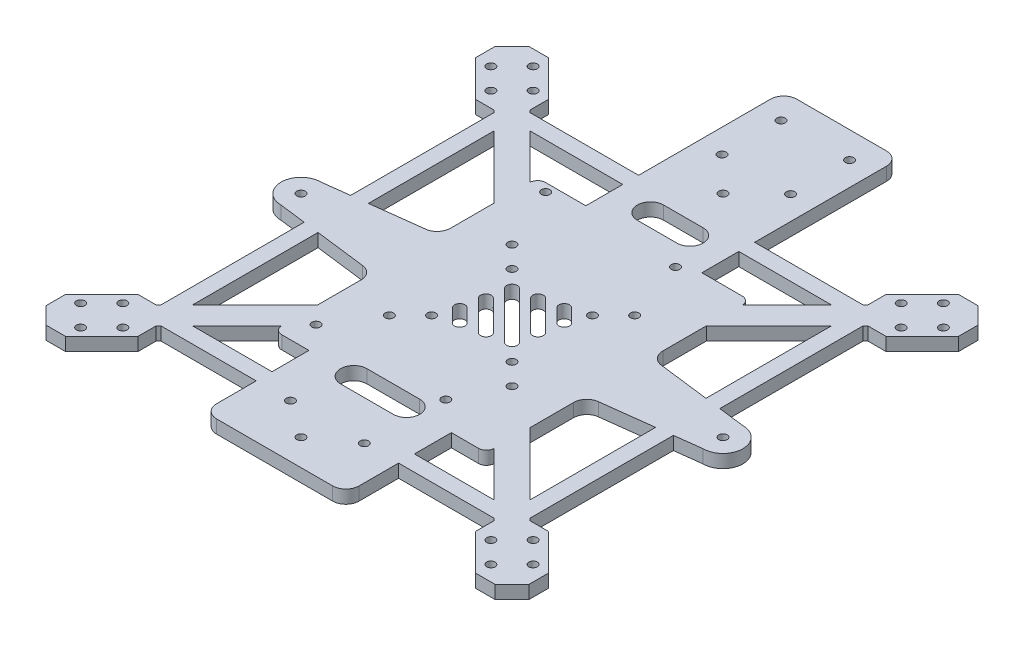
from build123d import *

# Parameters (mm, degrees)
SKETCH_1_R           = 1.6
EXTRUDE_1_DEPTH      = 5
SKETCH_6_R           = 1.6
EXTRUDE_3_DEPTH      = 5
SKETCH_7_R           = 1.6
CUT_EXTRUDE_5_DEPTH  = 130.541966274
SKETCH_8_W           = 44
SKETCH_8_H           = 75
SKETCH_8_R           = 1.6
EXTRUDE_4_DEPTH      = 5
FILLET_1_R           = 5
FILLET_2_R           = 3
EXTRUDE_6_DEPTH      = 5
SKETCH_10_R          = 1.6
CUT_EXTRUDE_10_DEPTH = 156.009872308


with BuildPart() as part:
    # 草图1 → 凸台-拉伸1 (new body)
    with BuildSketch(Plane(origin=(0, 0, 0), x_dir=(1, 0, 0), z_dir=(0, 1, 0))):
        with BuildLine():
            Line((-40.28, -16.916429648), (-40.28, -50))
            Line((-40.28, -50), (-27, -50))
            Line((-27, -50), (-27, -90))
            Line((-27, -90), (27, -90))
            Line((27, -90), (27, -50))
            Line((27, -50), (40.28, -50))
            Line((40.28, -50), (40.28, -16.916429648))
            ThreePointArc((40.28, -16.916429648), (41.5325458, -13.606356081), (44.662634807, -11.954690012))
            Line((44.662634807, -11.954690012), (80, -7.557833088))
            ThreePointArc((80, -7.557833088), (87.557833088, 0), (80, 7.557833088))
            Line((80, 7.557833088), (44.662634807, 11.954690012))
            ThreePointArc((44.662634807, 11.954690012), (41.5325458, 13.606356081), (40.28, 16.916429648))
            Line((40.28, 16.916429648), (40.28, 50))
            Line((40.28, 50), (-40.28, 50))
            Line((-40.28, 50), (-40.28, 16.916429648))
            ThreePointArc((-40.28, 16.916429648), (-41.5325458, 13.606356081), (-44.662634807, 11.954690012))
            Line((-44.662634807, 11.954690012), (-80, 7.557833088))
            ThreePointArc((-80, 7.557833088), (-87.557833088, 0), (-80, -7.557833088))
            Line((-80, -7.557833088), (-44.662634807, -11.954690012))
            ThreePointArc((-44.662634807, -11.954690012), (-41.5325458, -13.606356081), (-40.28, -16.916429648))
        make_face()
        with Locations(Location((-34.12, -40.19, 0), (0, 0, 270))):
            Circle(SKETCH_1_R, mode=Mode.SUBTRACT)
        with Locations(Location((15.09, -40.19, 0), (0, 0, 270))):
            Circle(SKETCH_1_R, mode=Mode.SUBTRACT)
        with Locations(Location((-80, 0, 0), (0, 0, 270))):
            Circle(SKETCH_1_R, mode=Mode.SUBTRACT)
        with Locations(Location((-15.25, -15.25, 0), (0, 0, 270))):
            Circle(SKETCH_1_R, mode=Mode.SUBTRACT)
        with Locations(Location((-15.25, 15.25, 0), (0, 0, 270))):
            Circle(SKETCH_1_R, mode=Mode.SUBTRACT)
        with Locations(Location((-34.12, 46.89, 0), (0, 0, 270))):
            Circle(SKETCH_1_R, mode=Mode.SUBTRACT)
        with Locations(Location((15.25, -15.25, 0), (0, 0, 270))):
            Circle(SKETCH_1_R, mode=Mode.SUBTRACT)
        with Locations(Location((80, 0, 0), (0, 0, 270))):
            Circle(SKETCH_1_R, mode=Mode.SUBTRACT)
        with Locations(Location((15.25, 15.25, 0), (0, 0, 270))):
            Circle(SKETCH_1_R, mode=Mode.SUBTRACT)
        with Locations(Location((15.09, 46.89, 0), (0, 0, 270))):
            Circle(SKETCH_1_R, mode=Mode.SUBTRACT)
        with Locations(Location((14, -70, 0), (0, 0, 270))):
            Circle(SKETCH_1_R, mode=Mode.SUBTRACT)
        with Locations(Location((-14, -70, 0), (0, 0, 270))):
            Circle(SKETCH_1_R, mode=Mode.SUBTRACT)
    extrude(amount=EXTRUDE_1_DEPTH)

    # 草图6 → 凸台-拉伸3 (add)
    # profile 1 of 4: a face of its own
    with BuildSketch(Plane(origin=(0, 0, 0), x_dir=(1, 0, 0), z_dir=(0, 1, 0))):
        Polygon((-40.28, 33.405), (-40.28, 47.155), (-64.031745931, 70.906745931), (-64.031745931, 77.781745931), (-77.781745931, 91.531745931), (-85.1677849, 91.531745931), (-91.531745931, 85.1677849), (-91.531745931, 77.781745931), (-77.781745931, 64.031745931), (-70.906745931, 64.031745931), align=None)
        with Locations(Location((-85.781745931, 77.781745931, 0), (0, 0, 270))):
            Circle(SKETCH_6_R, mode=Mode.SUBTRACT)
        with Locations(Location((-77.781745931, 69.781745931, 0), (0, 0, 270))):
            Circle(SKETCH_6_R, mode=Mode.SUBTRACT)
        with Locations(Location((-69.781745931, 77.781745931, 0), (0, 0, 270))):
            Circle(SKETCH_6_R, mode=Mode.SUBTRACT)
        with Locations(Location((-77.781745931, 85.781745931, 0), (0, 0, 270))):
            Circle(SKETCH_6_R, mode=Mode.SUBTRACT)
    # profile 2 of 4: a face of its own
    with BuildSketch(Plane(origin=(0, 0, 0), x_dir=(1, 0, 0), z_dir=(0, 1, 0))):
        Polygon((85.1677849, 91.531745931), (77.781745931, 91.531745931), (64.031745931, 77.781745931), (64.031745931, 70.906745931), (40.28, 47.155), (40.28, 33.405), (70.906745931, 64.031745931), (77.781745931, 64.031745931), (91.531745931, 77.781745931), (91.531745931, 85.1677849), align=None)
        with Locations(Location((77.781745931, 69.781745931, 0), (0, 0, 270))):
            Circle(SKETCH_6_R, mode=Mode.SUBTRACT)
        with Locations(Location((69.781745931, 77.781745931, 0), (0, 0, 270))):
            Circle(SKETCH_6_R, mode=Mode.SUBTRACT)
        with Locations(Location((85.781745931, 77.781745931, 0), (0, 0, 270))):
            Circle(SKETCH_6_R, mode=Mode.SUBTRACT)
        with Locations(Location((77.781745931, 85.781745931, 0), (0, 0, 270))):
            Circle(SKETCH_6_R, mode=Mode.SUBTRACT)
    # profile 3 of 4: a face of its own
    with BuildSketch(Plane(origin=(0, 0, 0), x_dir=(1, 0, 0), z_dir=(0, 1, 0))):
        Polygon((70.906745931, -64.031745931), (40.28, -33.405), (40.28, -47.155), (64.031745931, -70.906745931), (64.031745931, -77.781745931), (77.781745931, -91.531745931), (85.1677849, -91.531745931), (91.531745931, -85.1677849), (91.531745931, -77.781745931), (77.781745931, -64.031745931), align=None)
        with Locations(Location((77.781745931, -85.781745931, 0), (0, 0, 270))):
            Circle(SKETCH_6_R, mode=Mode.SUBTRACT)
        with Locations(Location((69.781745931, -77.781745931, 0), (0, 0, 270))):
            Circle(SKETCH_6_R, mode=Mode.SUBTRACT)
        with Locations(Location((77.781745931, -69.781745931, 0), (0, 0, 270))):
            Circle(SKETCH_6_R, mode=Mode.SUBTRACT)
        with Locations(Location((85.781745931, -77.781745931, 0), (0, 0, 270))):
            Circle(SKETCH_6_R, mode=Mode.SUBTRACT)
    # profile 4 of 4: a face of its own
    with BuildSketch(Plane(origin=(0, 0, 0), x_dir=(1, 0, 0), z_dir=(0, 1, 0))):
        Polygon((-40.28, -47.155), (-40.28, -33.405), (-70.906745931, -64.031745931), (-77.781745931, -64.031745931), (-91.531745931, -77.781745931), (-91.531745931, -85.1677849), (-85.1677849, -91.531745931), (-77.781745931, -91.531745931), (-64.031745931, -77.781745931), (-64.031745931, -70.906745931), align=None)
        with Locations(Location((-77.781745931, -85.781745931, 0), (0, 0, 270))):
            Circle(SKETCH_6_R, mode=Mode.SUBTRACT)
        with Locations(Location((-85.781745931, -77.781745931, 0), (0, 0, 270))):
            Circle(SKETCH_6_R, mode=Mode.SUBTRACT)
        with Locations(Location((-69.781745931, -77.781745931, 0), (0, 0, 270))):
            Circle(SKETCH_6_R, mode=Mode.SUBTRACT)
        with Locations(Location((-77.781745931, -69.781745931, 0), (0, 0, 270))):
            Circle(SKETCH_6_R, mode=Mode.SUBTRACT)
    extrude(amount=EXTRUDE_3_DEPTH)

    # 草图7 → 切除-拉伸5 (cut, through all)
    with BuildSketch(Plane(origin=(0, 0, 0), x_dir=(1, 0, 0), z_dir=(0, 1, 0))):
        with BuildLine():
            ThreePointArc((-6.01040764, -10.960155108), (-6.01040764, -13.788582233), (-8.838834765, -13.788582233))
            Line((-8.838834765, -13.788582233), (-13.788582233, -8.838834765))
            ThreePointArc((-13.788582233, -8.838834765), (-13.788582233, -6.01040764), (-10.960155108, -6.01040764))
            Line((-10.960155108, -6.01040764), (-6.01040764, -10.960155108))
        make_face()
        with BuildLine():
            ThreePointArc((2.121320344, -9.192388155), (2.121320344, -12.02081528), (-0.707106781, -12.02081528))
            Line((-0.707106781, -12.02081528), (-12.02081528, -0.707106781))
            ThreePointArc((-12.02081528, -0.707106781), (-12.02081528, 2.121320344), (-9.192388155, 2.121320344))
            Line((-9.192388155, 2.121320344), (2.121320344, -9.192388155))
        make_face()
        with BuildLine():
            Line((-10.253048327, 7.424621202), (7.424621202, -10.253048327))
            ThreePointArc((7.424621202, -10.253048327), (10.253048327, -10.253048327), (10.253048327, -7.424621202))
            Line((10.253048327, -7.424621202), (-7.424621202, 10.253048327))
            ThreePointArc((-7.424621202, 10.253048327), (-10.253048327, 10.253048327), (-10.253048327, 7.424621202))
        make_face()
        with BuildLine():
            Line((-2.121320344, 9.192388155), (9.192388155, -2.121320344))
            ThreePointArc((9.192388155, -2.121320344), (12.02081528, -2.121320344), (12.02081528, 0.707106781))
            Line((12.02081528, 0.707106781), (0.707106781, 12.02081528))
            ThreePointArc((0.707106781, 12.02081528), (-2.121320344, 12.02081528), (-2.121320344, 9.192388155))
        make_face()
        with BuildLine():
            Line((6.01040764, 10.960155108), (10.960155108, 6.01040764))
            ThreePointArc((10.960155108, 6.01040764), (13.788582233, 6.01040764), (13.788582233, 8.838834765))
            Line((13.788582233, 8.838834765), (8.838834765, 13.788582233))
            ThreePointArc((8.838834765, 13.788582233), (6.01040764, 13.788582233), (6.01040764, 10.960155108))
        make_face()
        with BuildLine():
            Line((-10, -55), (10, -55))
            ThreePointArc((10, -55), (15, -50), (10, -45))
            Line((10, -45), (-10, -45))
            ThreePointArc((-10, -45), (-15, -50), (-10, -55))
        make_face()
        with Locations(Location((0, -80, 0), (0, 0, 270))):
            Circle(SKETCH_7_R)
    extrude(amount=CUT_EXTRUDE_5_DEPTH, mode=Mode.SUBTRACT)

    # 草图8 → 凸台-拉伸4 (add)
    with BuildSketch(Plane(origin=(0, 0, 0), x_dir=(1, 0, 0), z_dir=(0, 1, 0))):
        with Locations((0, 87.5)):
            Rectangle(SKETCH_8_W, SKETCH_8_H)
        with Locations(Location((13, 115, 0), (0, 0, 270))):
            Circle(SKETCH_8_R, mode=Mode.SUBTRACT)
        with Locations(Location((-13, 115, 0), (0, 0, 90))):
            Circle(SKETCH_8_R, mode=Mode.SUBTRACT)
        with Locations(Location((13, 92.63, 0), (0, 0, 270))):
            Circle(SKETCH_8_R, mode=Mode.SUBTRACT)
        with Locations(Location((-13, 92.63, 0), (0, 0, 90))):
            Circle(SKETCH_8_R, mode=Mode.SUBTRACT)
        with Locations(Location((0, 80, 0), (0, 0, 270))):
            Circle(SKETCH_8_R, mode=Mode.SUBTRACT)
        with BuildLine():
            Line((-7.5, 65), (7.5, 65))
            ThreePointArc((7.5, 65), (12.5, 60), (7.5, 55))
            Line((7.5, 55), (-7.5, 55))
            ThreePointArc((-7.5, 55), (-12.5, 60), (-7.5, 65))
        make_face(mode=Mode.SUBTRACT)
    extrude(amount=EXTRUDE_4_DEPTH)

    # 圆角1
    fillet_1_edges = [part.edges().sort_by_distance(p)[0] for p in [
        (22, 2.5, -125),
        (-22, 2.5, -125),
        (27, 2.5, 90),
        (-27, 2.5, 90),
    ]]
    fillet(fillet_1_edges, radius=FILLET_1_R)

    # 圆角2
    # the kernel refuses this fillet: 3 mm, written as the material it takes off along each edge
    with BuildSketch(Plane(origin=(-40.28, -7.489982894, 50), x_dir=(1, 0, 0), z_dir=(0, 1, 0))) as fillet_2_piece_1_section:
        with BuildLine():
            CenterArc((2.995993158, 3), FILLET_2_R, 182.961600578, 87.038399422)
            Line((0, 2.845), (-0.059919863, 2.8419))
            ThreePointArc((-0.059919863, 2.8419), (-0.06, 1.4225), (-0.06, 0))
            Line((-0.06, 0), (0, -0.06))
            Line((0, -0.06), (2.995993158, -0.06))
            Line((2.995993158, -0.06), (2.995993158, 0))
        make_face()
    fillet_2_piece_1 = extrude(amount=19.979965788, mode=Mode.PRIVATE)
    fillet_2_piece_1 = split(fillet_2_piece_1, bisect_by=Plane(origin=(-41.028477844, 2.5, 47.903477844), z_dir=(0.7071067811865611, 0, 0.7071067811865339)), keep=Keep.TOP, mode=Mode.PRIVATE)
    add(fillet_2_piece_1, mode=Mode.SUBTRACT)
    with BuildSketch(Plane(origin=(40.28, -7.489982894, 50), x_dir=(-1, 0, 0), z_dir=(0, 1, 0))) as fillet_2_piece_2_section:
        with BuildLine():
            CenterArc((2.995993158, -3), FILLET_2_R, 90, 87.038399422)
            Line((0, -2.845), (-0.059919863, -2.8419))
            ThreePointArc((-0.059919863, -2.8419), (-0.06, -1.4225), (-0.06, 0))
            Line((-0.06, 0), (0, 0.06))
            Line((0, 0.06), (2.995993158, 0.06))
            Line((2.995993158, 0.06), (2.995993158, 0))
        make_face()
    fillet_2_piece_2 = extrude(amount=19.979965788, mode=Mode.PRIVATE)
    fillet_2_piece_2 = split(fillet_2_piece_2, bisect_by=Plane(origin=(41.028477844, 2.5, 47.903477844), z_dir=(-0.7071067811865506, 0, 0.7071067811865445)), keep=Keep.TOP, mode=Mode.PRIVATE)
    add(fillet_2_piece_2, mode=Mode.SUBTRACT)
    with BuildSketch(Plane(origin=(40.28, -7.489982894, -50), x_dir=(0, 0, 1), z_dir=(0, 1, 0))) as fillet_2_piece_3_section:
        with BuildLine():
            CenterArc((3, -2.995993158), FILLET_2_R, 92.961600577, 87.038399423)
            Line((0, -2.995993158), (-0.06, -2.995993158))
            Line((-0.06, -2.995993158), (-0.06, 0))
            Line((-0.06, 0), (0, 0.06))
            ThreePointArc((0, 0.06), (1.4225, 0.06), (2.8419, 0.059919863))
            Line((2.8419, 0.059919863), (2.845, 0))
        make_face()
    fillet_2_piece_3 = extrude(amount=19.979965788, mode=Mode.PRIVATE)
    fillet_2_piece_3 = split(fillet_2_piece_3, bisect_by=Plane(origin=(41.028477844, 2.5, -47.903477844), z_dir=(-0.7071067811865489, 0, -0.7071067811865461)), keep=Keep.TOP, mode=Mode.PRIVATE)
    add(fillet_2_piece_3, mode=Mode.SUBTRACT)
    with BuildSketch(Plane(origin=(-40.28, -7.489982894, -50), x_dir=(0, 0, 1), z_dir=(0, 1, 0))) as fillet_2_piece_4_section:
        with BuildLine():
            CenterArc((3, 2.995993158), FILLET_2_R, 180, 87.038399422)
            Line((0, 2.995993158), (-0.06, 2.995993158))
            Line((-0.06, 2.995993158), (-0.06, 0))
            Line((-0.06, 0), (0, -0.06))
            ThreePointArc((0, -0.06), (1.4225, -0.06), (2.8419, -0.059919863))
            Line((2.8419, -0.059919863), (2.845, 0))
        make_face()
    fillet_2_piece_4 = extrude(amount=19.979965788, mode=Mode.PRIVATE)
    fillet_2_piece_4 = split(fillet_2_piece_4, bisect_by=Plane(origin=(-41.028477844, 2.5, -47.903477844), z_dir=(0.7071067811865613, 0, -0.7071067811865338)), keep=Keep.TOP, mode=Mode.PRIVATE)
    add(fillet_2_piece_4, mode=Mode.SUBTRACT)

    # 草图9 → 凸台-拉伸6 (add)
    with BuildSketch(Plane(origin=(0, 0, 0), x_dir=(1, 0, 0), z_dir=(0, 1, 0))):
        Polygon((64, 9.54863547), (64, 57.125), (70, 63.125), (70, 8.802084577), align=None)
        Polygon((-57.125, -64), (-27, -64), (-27, -70), (-63.125, -70), align=None)
        Polygon((-64, -57.125), (-64, -9.54863547), (-70, -8.802084577), (-70, -63.125), align=None)
        Polygon((-57.125, 64), (-22, 64), (-22, 70), (-63.125, 70), align=None)
        Polygon((64, -57.125), (64, -9.54863547), (70, -8.802084577), (70, -63.125), align=None)
        Polygon((22, 64), (22, 70), (63.125, 70), (57.125, 64), align=None)
        Polygon((-64, 9.54863547), (-64, 57.125), (-70, 63.125), (-70, 8.802084577), align=None)
        Polygon((27, -64), (57.125, -64), (63.125, -70), (27, -70), align=None)
    extrude(amount=EXTRUDE_6_DEPTH)

    # 草图10 → 切除-拉伸10 (cut, through all)
    with BuildSketch(Plane(origin=(0, 0, 0), x_dir=(1, 0, 0), z_dir=(0, 1, 0))):
        with Locations(Location((-23.25, 23.25, 0), (0, 0, 270))):
            Circle(SKETCH_10_R)
        with Locations(Location((23.25, 23.25, 0), (0, 0, 270))):
            Circle(SKETCH_10_R)
        with Locations(Location((23.25, -23.25, 0), (0, 0, 270))):
            Circle(SKETCH_10_R)
        with Locations(Location((-23.25, -23.25, 0), (0, 0, 270))):
            Circle(SKETCH_10_R)
    extrude(amount=CUT_EXTRUDE_10_DEPTH, mode=Mode.SUBTRACT)


solid = part.part
